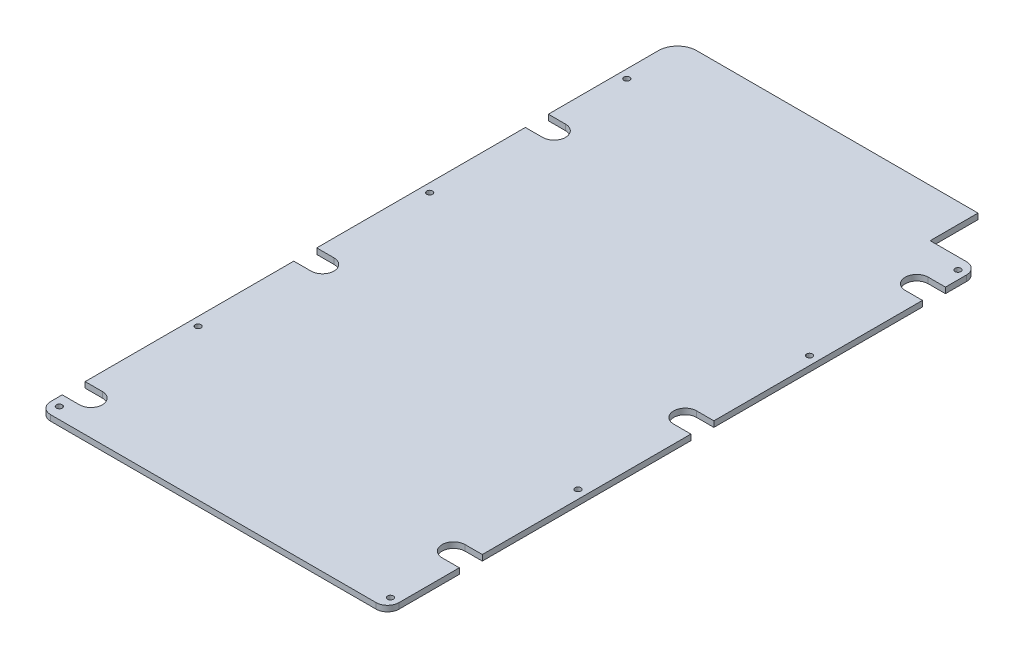
from build123d import *

# Parameters (mm, degrees)
SKETCH1_R           = 1.524
BOSS_EXTRUDE1_DEPTH = 3
FILLET1_R           = 10
FILLET2_R           = 6


with BuildPart() as part:
    # Sketch1 → Boss-Extrude1 (new body)
    with BuildSketch(Plane(origin=(0, 0, 0), x_dir=(1, 0, 0), z_dir=(0, 1, 0))):
        with BuildLine():
            Line((-91, 111.746910853), (-82, 111.746910853))
            ThreePointArc((-82, 111.746910853), (-76, 105.746910853), (-82, 99.746910853))
            Line((-82, 99.746910853), (-91, 99.746910853))
            Line((-91, 99.746910853), (-91, -9.253089147))
            Line((-91, -9.253089147), (-82, -9.253089147))
            ThreePointArc((-82, -9.253089147), (-76, -15.253089147), (-82, -21.253089147))
            Line((-82, -21.253089147), (-91, -21.253089147))
            Line((-91, -21.253089147), (-91, -130.253089147))
            Line((-91, -130.253089147), (-82, -130.253089147))
            ThreePointArc((-82, -130.253089147), (-76, -136.253089147), (-82, -142.253089147))
            Line((-82, -142.253089147), (-91, -142.253089147))
            Line((-91, -142.253089147), (-91, -154.253089147))
            Line((-91, -154.253089147), (91, -154.253089147))
            Line((91, -154.253089147), (91, -116.753089147))
            Line((91, -116.753089147), (82, -116.753089147))
            ThreePointArc((82, -116.753089147), (76, -110.753089147), (82, -104.753089147))
            Line((82, -104.753089147), (91, -104.753089147))
            Line((91, -104.753089147), (91, 4.246910853))
            Line((91, 4.246910853), (82, 4.246910853))
            ThreePointArc((82, 4.246910853), (76, 10.246910853), (82, 16.246910853))
            Line((82, 16.246910853), (91, 16.246910853))
            Line((91, 16.246910853), (91, 125.246910853))
            Line((91, 125.246910853), (82, 125.246910853))
            ThreePointArc((82, 125.246910853), (76, 131.246910853), (82, 137.246910853))
            Line((82, 137.246910853), (91, 137.246910853))
            Line((91, 137.246910853), (91, 154.253089147))
            Line((91, 154.253089147), (66, 154.253089147))
            Line((66, 154.253089147), (66, 179.253089147))
            Line((66, 179.253089147), (-91, 179.253089147))
            Line((-91, 179.253089147), (-91, 111.746910853))
        make_face()
        with Locations((-86.5, -148.253089147)):
            Circle(SKETCH1_R, mode=Mode.SUBTRACT)
        with Locations((-86.5, -75.753089147)):
            Circle(SKETCH1_R, mode=Mode.SUBTRACT)
        with Locations((86.5, -148.253089147)):
            Circle(SKETCH1_R, mode=Mode.SUBTRACT)
        with Locations((86.5, -50.253089147)):
            Circle(SKETCH1_R, mode=Mode.SUBTRACT)
        with Locations((-86.5, 45.246910853)):
            Circle(SKETCH1_R, mode=Mode.SUBTRACT)
        with Locations((-86.5, 148.253089147)):
            Circle(SKETCH1_R, mode=Mode.SUBTRACT)
        with Locations((86.5, 70.746910853)):
            Circle(SKETCH1_R, mode=Mode.SUBTRACT)
        with Locations((86.5, 148.253089147)):
            Circle(SKETCH1_R, mode=Mode.SUBTRACT)
    extrude(amount=BOSS_EXTRUDE1_DEPTH)

    # Fillet1
    fillet1_edges = [part.edges().sort_by_distance(p)[0] for p in [
        (-91, 1.5, -179.253089147),
    ]]
    fillet(fillet1_edges, radius=FILLET1_R)

    # Fillet2
    fillet2_edges = [part.edges().sort_by_distance(p)[0] for p in [
        (91, 1.5, 154.253089147),
        (-91, 1.5, 154.253089147),
        (91, 1.5, -154.253089147),
    ]]
    fillet(fillet2_edges, radius=FILLET2_R)


solid = part.part
